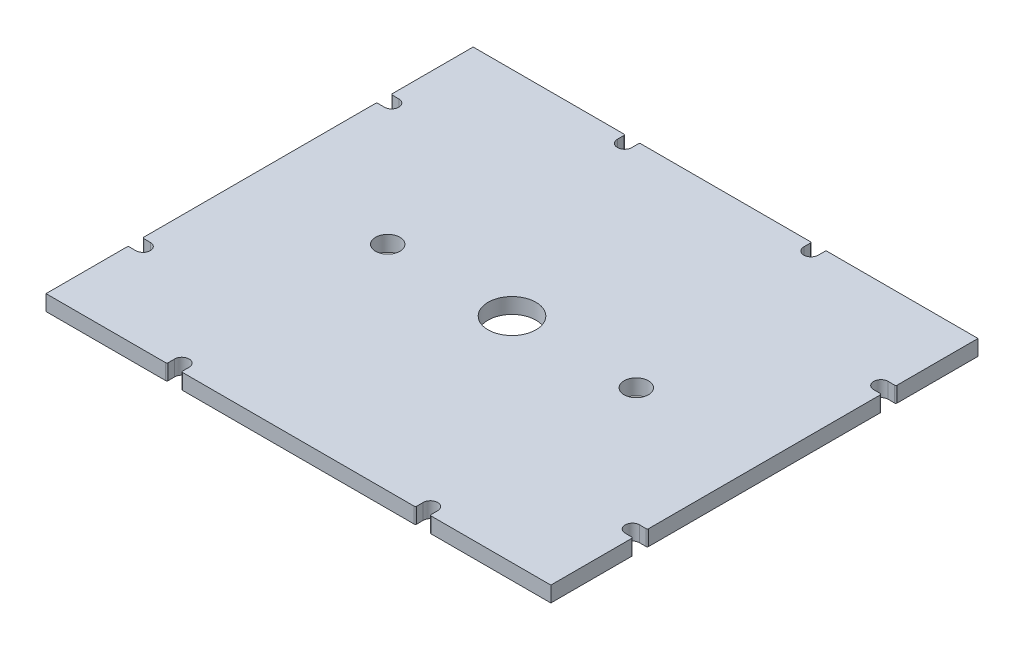
from build123d import *

# Parameters (mm, degrees)
SKETCH1_W                  = 103.1875
SKETCH1_H                  = 87.3125
BOSS_EXTRUDE1_DEPTH        = 3.175
CUT_EXTRUDE1_DEPTH         = 68.659913007
CUT_EXTRUDE2_DEPTH         = 68.659913007
FILLET1_R                  = 0.254
SKETCH10_R                 = 4.8895
CUT_EXTRUDE3_DEPTH         = 68.659913007
F_10_CLEARANCE_HOLE1_D     = 4.9784
F_10_CLEARANCE_HOLE1_DEPTH = 10.16
F_10_CLEARANCE_HOLE1_TIP   = 1.495662253


with BuildPart() as part:
    # Sketch1 → Boss-Extrude1 (new body)
    with BuildSketch(Plane(origin=(0, 0, 0), x_dir=(1, 0, 0), z_dir=(0, 1, 0))):
        Rectangle(SKETCH1_W, SKETCH1_H)
    extrude(amount=BOSS_EXTRUDE1_DEPTH)

    # Sketch4 → Cut-Extrude1 (cut, through all)
    with BuildSketch(Plane.XZ):
        with BuildLine():
            Line((50.00625, -26.8732), (51.59375, -26.8732))
            Line((51.59375, -26.8732), (51.59375, -23.9268))
            Line((51.59375, -23.9268), (50.00625, -23.9268))
            ThreePointArc((50.00625, -23.9268), (48.53305, -25.4), (50.00625, -26.8732))
        make_face()
        with BuildLine():
            Line((50.00625, 26.8732), (51.59375, 26.8732))
            Line((51.59375, 26.8732), (51.59375, 23.9268))
            Line((51.59375, 23.9268), (50.00625, 23.9268))
            ThreePointArc((50.00625, 23.9268), (48.53305, 25.4), (50.00625, 26.8732))
        make_face()
        with BuildLine():
            Line((-50.00625, 26.8732), (-51.59375, 26.8732))
            Line((-51.59375, 26.8732), (-51.59375, 23.9268))
            Line((-51.59375, 23.9268), (-50.00625, 23.9268))
            ThreePointArc((-50.00625, 23.9268), (-48.53305, 25.4), (-50.00625, 26.8732))
        make_face()
        with BuildLine():
            Line((-50.00625, -23.9268), (-51.59375, -23.9268))
            Line((-51.59375, -23.9268), (-51.59375, -26.8732))
            Line((-51.59375, -26.8732), (-50.00625, -26.8732))
            ThreePointArc((-50.00625, -26.8732), (-48.53305, -25.4), (-50.00625, -23.9268))
        make_face()
    extrude(amount=-CUT_EXTRUDE1_DEPTH, mode=Mode.SUBTRACT)

    # Sketch9 → Cut-Extrude2 (cut, through all)
    with BuildSketch(Plane.XZ):
        with BuildLine():
            Line((17.5768, -42.06875), (17.5768, -43.65625))
            Line((17.5768, -43.65625), (20.5232, -43.65625))
            Line((20.5232, -43.65625), (20.5232, -42.06875))
            ThreePointArc((20.5232, -42.06875), (19.05, -40.59555), (17.5768, -42.06875))
        make_face()
        with BuildLine():
            Line((-20.5232, -42.06875), (-20.5232, -43.65625))
            Line((-20.5232, -43.65625), (-17.5768, -43.65625))
            Line((-17.5768, -43.65625), (-17.5768, -42.06875))
            ThreePointArc((-17.5768, -42.06875), (-19.05, -40.59555), (-20.5232, -42.06875))
        make_face()
        with BuildLine():
            Line((23.9268, 43.65625), (23.9268, 42.06875))
            ThreePointArc((23.9268, 42.06875), (25.4, 40.59555), (26.8732, 42.06875))
            Line((26.8732, 42.06875), (26.8732, 43.65625))
            Line((26.8732, 43.65625), (23.9268, 43.65625))
        make_face()
        with BuildLine():
            Line((-26.8732, 43.65625), (-26.8732, 42.06875))
            ThreePointArc((-26.8732, 42.06875), (-25.4, 40.59555), (-23.9268, 42.06875))
            Line((-23.9268, 42.06875), (-23.9268, 43.65625))
            Line((-23.9268, 43.65625), (-26.8732, 43.65625))
        make_face()
    extrude(amount=-CUT_EXTRUDE2_DEPTH, mode=Mode.SUBTRACT)

    # Fillet1
    fillet1_edges = [part.edges().sort_by_distance(p)[0] for p in [
        (20.5232, 1.5875, -43.65625),
        (17.5768, 1.5875, -43.65625),
        (-17.5768, 1.5875, -43.65625),
        (-20.5232, 1.5875, -43.65625),
        (-51.59375, 1.5875, -23.9268),
        (-51.59375, 1.5875, -26.8732),
        (-51.59375, 1.5875, 26.8732),
        (-51.59375, 1.5875, 23.9268),
        (-26.8732, 1.5875, 43.65625),
        (-23.9268, 1.5875, 43.65625),
        (26.8732, 1.5875, 43.65625),
        (23.9268, 1.5875, 43.65625),
        (51.59375, 1.5875, 26.8732),
        (51.59375, 1.5875, 23.9268),
        (51.59375, 1.5875, -23.9268),
        (51.59375, 1.5875, -26.8732),
    ]]
    fillet(fillet1_edges, radius=FILLET1_R)

    # Sketch10 → Cut-Extrude3 (cut, through all)
    with BuildSketch(Plane.XZ):
        Circle(SKETCH10_R)
    extrude(amount=-CUT_EXTRUDE3_DEPTH, mode=Mode.SUBTRACT)

    # #10 Clearance Hole1
    with Locations(Plane(origin=(0, 0, 0), x_dir=(-1, 0, 0), z_dir=(0, -1, 0))):
        with Locations((-25.4, 0), (25.4, 0)):
            Hole(F_10_CLEARANCE_HOLE1_D / 2, depth=F_10_CLEARANCE_HOLE1_DEPTH)
            with Locations((0, 0, -(F_10_CLEARANCE_HOLE1_DEPTH + F_10_CLEARANCE_HOLE1_TIP / 2))):  # 118° drill point
                Cone(0, F_10_CLEARANCE_HOLE1_D / 2, F_10_CLEARANCE_HOLE1_TIP, mode=Mode.SUBTRACT)


solid = part.part
